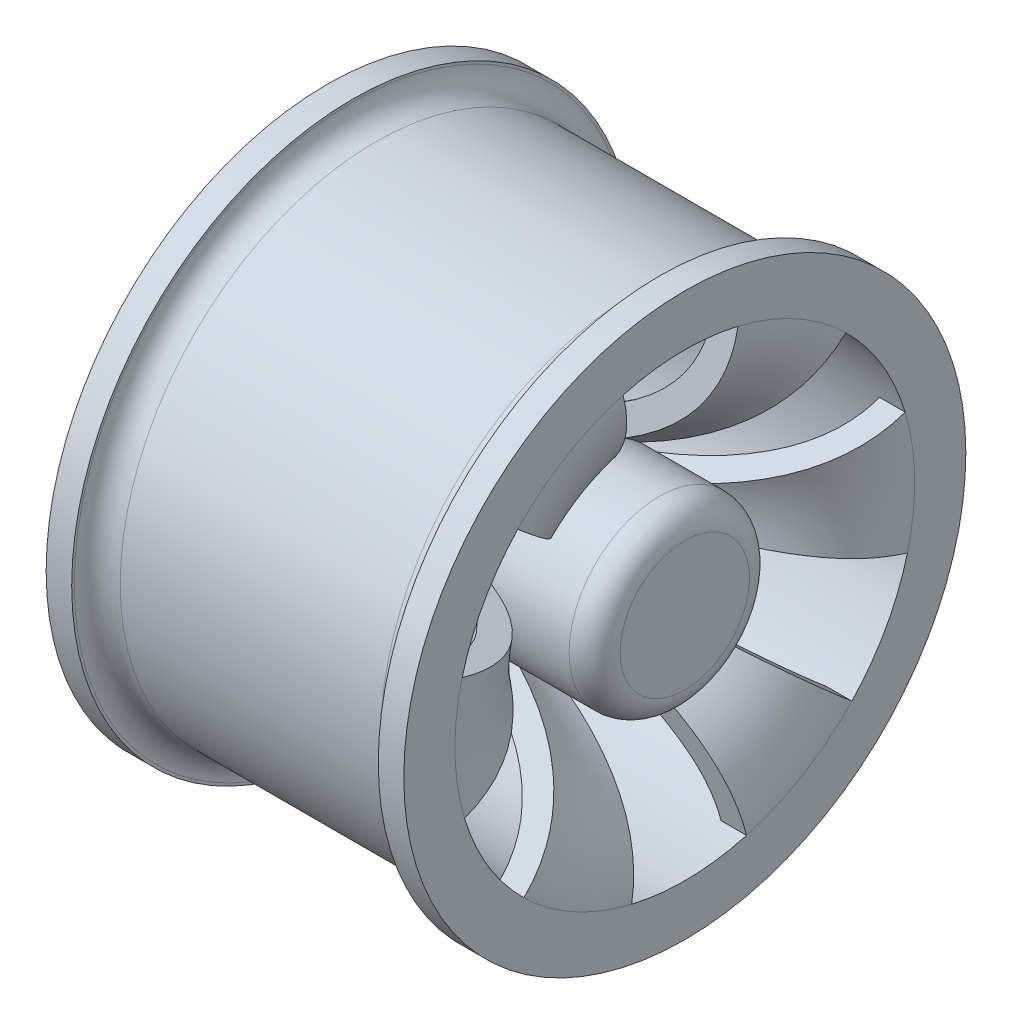
from build123d import *
from build123d.topology import SkipClean

# Parameters (mm, degrees)
BOSS_EXTRUDE1_DEPTH      = 17.78
BOSS_EXTRUDE1_DEPTH_BACK = 17.78
SKETCH2_R                = 8.967072844
SKETCH2_R_2              = 6.35
SKETCH3_R                = 8.967072844
BOSS_EXTRUDE2_DEPTH      = 5.08
CUT_EXTRUDE14_DEPTH      = 65.882742607
CIRPATTERN1_COUNT        = 6
FILLET1_R                = 2.54


# Read off the part's stored shape, not the designer's step: Revolve1
with BuildPart() as part:
    # Revolve1 outline → Revolve1 (revolve)
    with BuildSketch(Plane(origin=(0, -18.585402612, 0), x_dir=(0, 1, 0), z_dir=(0, 0, -1))):
        with BuildLine():
            Line((27.94, -27.948136074), (27.94, -25.408136074))
            Line((27.94, -25.408136074), (27.686, -25.408136074))
            ThreePointArc((27.686, -25.408136074), (26.069553898, -24.738582176), (25.4, -23.122136074))
            Line((25.4, -23.122136074), (25.4, 2.785863926))
            ThreePointArc((25.4, 2.785863926), (26.069553898, 4.402310028), (27.686, 5.071863926))
            Line((27.686, 5.071863926), (27.94, 5.071863926))
            Line((27.94, 5.071863926), (27.94, 7.611863926))
            Line((27.94, 7.611863926), (22.86, 7.611863926))
            add(Edge.make_bspline(
                [(22.86, 7.611863926), (13.201636215, 7.611863926), (8.135549362, -2.683795686), (6.35, -10.168136074)],
                knots=[0.692464509, 0.692464509, 0.692464509, 0.692464509, 1.692464509, 1.692464509, 1.692464509, 1.692464509], degree=3))
            Line((6.35, -10.168136074), (8.967072844, -10.168136074))
            add(Edge.make_bspline(
                [(22.86, 5.071863926), (22.387198742, 5.071861598), (21.41969753, 5.006675284), (19.684992608, 4.643371102), (17.693982277, 3.788275186), (15.542445492, 2.175108381), (13.622233939, 0.045836041), (11.968948285, -2.474122809), (10.604254161, -5.233824051), (9.717392974, -7.58970308), (9.216637762, -9.234251105), (9.030531539, -9.922196096), (8.967072844, -10.168136074)],
                knots=[0, 0, 0, 0, 0.0625, 0.125, 0.25, 0.375, 0.5, 0.625, 0.75, 0.875, 0.9375, 0.972292377, 0.972292377, 0.972292377, 0.972292377], degree=3))
            Line((22.86, 5.071863926), (22.86, -27.948136074))
            Line((22.86, -27.948136074), (27.94, -27.948136074))
        make_face()
    revolve(axis=Axis((0, -18.585402612, 0), (1, 0, 0)))

    # Sketch2 → Boss-Extrude1 (add, two sides: drawn at the far end of the back side and taken through both)
    with SkipClean():  # the faces are left unmerged after this step: merging them gives an invalid solid
        with BuildSketch(Plane.ZY.offset(10.168136074).offset(-BOSS_EXTRUDE1_DEPTH_BACK)):
            with Locations((0, -18.585402612)):
                Circle(SKETCH2_R)
            with Locations((0, -18.585402612)):
                Circle(SKETCH2_R_2, mode=Mode.SUBTRACT)
        extrude(amount=BOSS_EXTRUDE1_DEPTH + BOSS_EXTRUDE1_DEPTH_BACK)

    # Sketch3 → Boss-Extrude2 (add)
    with BuildSketch(Plane(origin=(7.611863926, 0, 0), x_dir=(0, 0, -1), z_dir=(1, 0, 0))):
        with Locations(Location((0, -18.585402612, 0), (0, 0, 180))):
            Circle(SKETCH3_R)
    extrude(amount=-BOSS_EXTRUDE2_DEPTH)

    # Sketch4 → Cut-Extrude14 (cut, through all)
    with BuildSketch(Plane(origin=(7.611863926, 0, 0), x_dir=(0, 0, -1), z_dir=(1, 0, 0))):
        with BuildLine():
            Line((-6.135854075, 3.435743924), (-2.812942312, -10.070958946))
            ThreePointArc((-2.812942312, -10.070958946), (0, -9.618329768), (2.812942312, -10.070958946))
            Line((2.812942312, -10.070958946), (5.292069409, 3.653608188))
            ThreePointArc((5.292069409, 3.653608188), (-0.435728528, 4.270444356), (-6.135854075, 3.435743924))
        make_face()
    cut_extrude14 = extrude(amount=-CUT_EXTRUDE14_DEPTH, mode=Mode.SUBTRACT)

    # CirPattern1: Cut-Extrude14 ×6 about axis
    with SkipClean():  # the faces are left unmerged after this step: merging them gives an invalid solid
        cirpattern1_axis = Axis((0, -18.585402612, 0), (1, 0, 0))
        for i in range(1, CIRPATTERN1_COUNT):
            add(cut_extrude14.rotate(cirpattern1_axis, i * 360 / CIRPATTERN1_COUNT), mode=Mode.SUBTRACT)
    add(part.part.scale(1), mode=Mode.REPLACE)  # the faces are merged on a copy

    # Fillet1
    fillet1_edges = [part.edges().sort_by_distance(p)[0] for p in [
        (7.611863926, -17.670049884, 8.920231206),
    ]]
    fillet(fillet1_edges, radius=FILLET1_R)


solid = part.part
